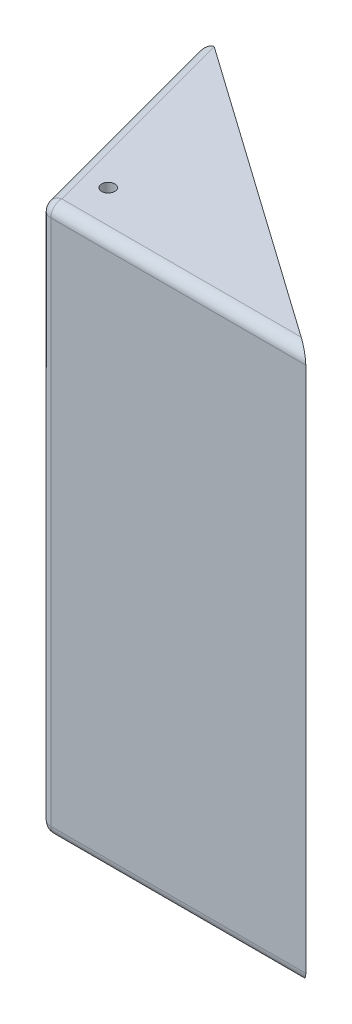
from build123d import *

# Parameters (mm, degrees)
BOSS_EXTRUDE1_DEPTH = 3.175
BOSS_EXTRUDE3_DEPTH = 152.4
BOSS_EXTRUDE4_DEPTH = 3.175
FILLET1_R           = 3.175
CHAMFER1_SIZE2      = 11.849261314
CHAMFER1_SIZE       = 3.175
SKETCH4_R           = 1.905
CUT_EXTRUDE1_DEPTH  = 158.75
CUT_EXTRUDE2_DEPTH  = 254


# Some blends are built 0.0001 mm under size
with BuildPart() as part:
    # Sketch1 → Boss-Extrude1 (new body)
    with BuildSketch(Plane(origin=(0, 0, 0), x_dir=(1, 0, 0), z_dir=(0, 1, 0))):
        Polygon((0, 0), (76.2, 0), (76.2, 63.5), (-17.014773719, 63.5), align=None)
    extrude(amount=BOSS_EXTRUDE1_DEPTH)

    # Sketch2 → Boss-Extrude3 (add)
    with BuildSketch(Plane(origin=(0, 3.175, 0), x_dir=(1, 0, 0), z_dir=(0, 1, 0))):
        Polygon((76.2, 0), (0, 0), (-17.014773719, 63.5), (-13.727771847, 63.5), (2.436263187, 3.175), (76.2, 3.175), align=None)
    extrude(amount=BOSS_EXTRUDE3_DEPTH)

    # Sketch3 → Boss-Extrude4 (add)
    with BuildSketch(Plane(origin=(0, 155.575, 0), x_dir=(1, 0, 0), z_dir=(0, 1, 0))):
        Polygon((-17.014773719, 63.5), (0, 0), (76.2, 0), (76.2, 63.5), align=None)
    extrude(amount=BOSS_EXTRUDE4_DEPTH)

    # Fillet1
    # the kernel refuses this fillet: 3.175 mm, written as the material it takes off along each edge
    with BuildSketch(Plane(origin=(2.436263187, 3.175, -3.175), x_dir=(-0.9659258262890689, 0, 0.2588190451025188), z_dir=(0, -1, 0))) as fillet1_piece_1_section:
        Polygon((0, 0), (FILLET1_R * 1.02, 0), (FILLET1_R * 1.02, -FILLET1_R * 0.782673527739), (FILLET1_R * 0.263995426005, -FILLET1_R * 0.985244342815), align=None)
    fillet1_piece_1 = extrude(amount=FILLET1_R * 1.02, mode=Mode.PRIVATE)
    fillet1_piece_1 = fillet1_piece_1 - Plane(origin=(2.436263187, 3.175, -3.175), x_dir=(0.6087614290087213, 0, -0.7933533402912346), z_dir=(0, -1, 0)) * Sphere(FILLET1_R, mode=Mode.PRIVATE)
    add(fillet1_piece_1, mode=Mode.SUBTRACT)
    with BuildSketch(Plane(origin=(2.436263187, 155.575, -3.175), x_dir=(0, 0, 1), z_dir=(0, 1, 0))) as fillet1_piece_2_section:
        Polygon((0, 0), (FILLET1_R * 1.02, 0), (FILLET1_R * 1.02, -FILLET1_R * 0.782673527739), (FILLET1_R * 0.263995426005, -FILLET1_R * 0.985244342815), align=None)
    fillet1_piece_2 = extrude(amount=FILLET1_R * 1.02, mode=Mode.PRIVATE)
    fillet1_piece_2 = fillet1_piece_2 - Plane(origin=(2.436263187, 155.575, -3.175), x_dir=(0.6087614290087213, 0, -0.7933533402912346), z_dir=(0, 1, 0)) * Sphere(FILLET1_R, mode=Mode.PRIVATE)
    add(fillet1_piece_2, mode=Mode.SUBTRACT)
    with BuildSketch(Plane(origin=(-17.014773719, 158.75, -63.5), x_dir=(1, 0, 0), z_dir=(0, -1, 0))) as fillet1_piece_3:
        with BuildLine():
            CenterArc((FILLET1_R * 1.30322537284, FILLET1_R), FILLET1_R, 165, 105)
            Line((FILLET1_R * 0.337299546552, FILLET1_R * 1.2588190451), (FILLET1_R * 0.317981030026, FILLET1_R * 1.263995426))
            Line((FILLET1_R * 0.317981030026, FILLET1_R * 1.263995426), (-FILLET1_R * 0.0260645074568, -FILLET1_R * 0.02))
            Line((-FILLET1_R * 0.0260645074568, -FILLET1_R * 0.02), (FILLET1_R * 1.30322537284, -FILLET1_R * 0.02))
            Line((FILLET1_R * 1.30322537284, -FILLET1_R * 0.02), (FILLET1_R * 1.30322537284, 0))
        make_face()
    extrude(amount=158.75, mode=Mode.SUBTRACT)
    with BuildSketch(Plane(origin=(2.436263187, 0, 0), x_dir=(0, 1, 0), z_dir=(1, 0, 0))) as fillet1_piece_4:
        with BuildLine():
            CenterArc((FILLET1_R, -FILLET1_R), FILLET1_R, 90, 90)
            Line((0, -FILLET1_R), (-FILLET1_R * 0.02, -FILLET1_R))
            Line((-FILLET1_R * 0.02, -FILLET1_R), (-FILLET1_R * 0.02, FILLET1_R * 0.02))
            Line((-FILLET1_R * 0.02, FILLET1_R * 0.02), (FILLET1_R, FILLET1_R * 0.02))
            Line((FILLET1_R, FILLET1_R * 0.02), (FILLET1_R, 0))
        make_face()
    extrude(amount=73.763736813, mode=Mode.SUBTRACT)
    with BuildSketch(Plane(origin=(-19.06914989, 0, -71.167036246), x_dir=(0.9659258262890688, 0, -0.25881904510251874), z_dir=(0.2588190451025188, 0, 0.9659258262890689))) as fillet1_piece_5_section:
        with BuildLine():
            CenterArc((FILLET1_R, FILLET1_R), FILLET1_R, 180, 90)
            Line((0, FILLET1_R), (-FILLET1_R * 0.02, FILLET1_R))
            Line((-FILLET1_R * 0.02, FILLET1_R), (-FILLET1_R * 0.02, -FILLET1_R * 0.02))
            Line((-FILLET1_R * 0.02, -FILLET1_R * 0.02), (FILLET1_R, -FILLET1_R * 0.02))
            Line((FILLET1_R, -FILLET1_R * 0.02), (FILLET1_R, 0))
        make_face()
    fillet1_piece_5 = extrude(amount=71.241274269, mode=Mode.PRIVATE)
    fillet1_piece_5 = split(fillet1_piece_5, bisect_by=Plane(origin=(-8.105416373, 0.719979608, -63.5), z_dir=(0, 0, 1)), keep=Keep.TOP, mode=Mode.PRIVATE)
    add(fillet1_piece_5, mode=Mode.SUBTRACT)
    with BuildSketch(Plane(origin=(0, 155.575, 0), x_dir=(1, 0, 0), z_dir=(0, -1, 0))) as fillet1_piece_6:
        with BuildLine():
            CenterArc((FILLET1_R * 0.767326987979, -FILLET1_R), FILLET1_R, 90, 75)
            Line((-FILLET1_R * 0.19859883831, -FILLET1_R * 0.741180954897), (-FILLET1_R * 0.217917354836, -FILLET1_R * 0.736004573995))
            Line((-FILLET1_R * 0.217917354836, -FILLET1_R * 0.736004573995), (-FILLET1_R * 0.0153465397596, FILLET1_R * 0.02))
            Line((-FILLET1_R * 0.0153465397596, FILLET1_R * 0.02), (FILLET1_R * 0.767326987979, FILLET1_R * 0.02))
            Line((FILLET1_R * 0.767326987979, FILLET1_R * 0.02), (FILLET1_R * 0.767326987979, 0))
        make_face()
    extrude(amount=152.4, mode=Mode.SUBTRACT)
    with BuildSketch(Plane(origin=(2.436263187, 158.75, 0), x_dir=(0, -1, 0), z_dir=(1, 0, 0))) as fillet1_piece_7:
        with BuildLine():
            CenterArc((FILLET1_R, FILLET1_R), FILLET1_R, 180, 90)
            Line((0, FILLET1_R), (-FILLET1_R * 0.02, FILLET1_R))
            Line((-FILLET1_R * 0.02, FILLET1_R), (-FILLET1_R * 0.02, -FILLET1_R * 0.02))
            Line((-FILLET1_R * 0.02, -FILLET1_R * 0.02), (FILLET1_R, -FILLET1_R * 0.02))
            Line((FILLET1_R, -FILLET1_R * 0.02), (FILLET1_R, 0))
        make_face()
    extrude(amount=73.763736813, mode=Mode.SUBTRACT)
    with BuildSketch(Plane(origin=(-19.06914989, 158.75, -71.167036246), x_dir=(0.9659258262890688, 0, -0.25881904510251874), z_dir=(0.2588190451025188, 0, 0.9659258262890689))) as fillet1_piece_8_section:
        with BuildLine():
            CenterArc((FILLET1_R, -FILLET1_R), FILLET1_R, 90, 90)
            Line((0, -FILLET1_R), (-FILLET1_R * 0.02, -FILLET1_R))
            Line((-FILLET1_R * 0.02, -FILLET1_R), (-FILLET1_R * 0.02, FILLET1_R * 0.02))
            Line((-FILLET1_R * 0.02, FILLET1_R * 0.02), (FILLET1_R, FILLET1_R * 0.02))
            Line((FILLET1_R, FILLET1_R * 0.02), (FILLET1_R, 0))
        make_face()
    fillet1_piece_8 = extrude(amount=71.241274269, mode=Mode.PRIVATE)
    fillet1_piece_8 = split(fillet1_piece_8, bisect_by=Plane(origin=(-8.105416373, 158.030020392, -63.5), z_dir=(0, 0, 1)), keep=Keep.TOP, mode=Mode.PRIVATE)
    add(fillet1_piece_8, mode=Mode.SUBTRACT)
    with BuildSketch(Plane(origin=(-17.014773719, 169.094351397, -63.5), x_dir=(1, 0, 0), z_dir=(0, -1, 0))) as fillet1_piece_9a_section:
        with BuildLine():
            CenterArc((FILLET1_R * 1.30322537284, FILLET1_R), FILLET1_R, 165, 105)
            Line((FILLET1_R * 0.337299546552, FILLET1_R * 1.2588190451), (FILLET1_R * 0.317981030026, FILLET1_R * 1.263995426))
            Line((FILLET1_R * 0.317981030026, FILLET1_R * 1.263995426), (-FILLET1_R * 0.0260645074568, -FILLET1_R * 0.02))
            Line((-FILLET1_R * 0.0260645074568, -FILLET1_R * 0.02), (FILLET1_R * 1.30322537284, -FILLET1_R * 0.02))
            Line((FILLET1_R * 1.30322537284, -FILLET1_R * 0.02), (FILLET1_R * 1.30322537284, 0))
        make_face()
    fillet1_piece_9a = extrude(amount=169.094351397, mode=Mode.PRIVATE)
    fillet1_piece_9a = split(fillet1_piece_9a, bisect_by=Plane(origin=(-15.793777483, 158.75, -62.563096636), z_dir=(0, 1, 0)), keep=Keep.TOP, mode=Mode.PRIVATE)
    with BuildSketch(Plane(origin=(-19.06914989, 158.75, -71.167036246), x_dir=(0.9659258262890688, 0, -0.25881904510251874), z_dir=(0.2588190451025188, 0, 0.9659258262890689))) as fillet1_piece_9b_section:
        with BuildLine():
            CenterArc((FILLET1_R, -FILLET1_R), FILLET1_R, 90, 90)
            Line((0, -FILLET1_R), (-FILLET1_R * 0.02, -FILLET1_R))
            Line((-FILLET1_R * 0.02, -FILLET1_R), (-FILLET1_R * 0.02, FILLET1_R * 0.02))
            Line((-FILLET1_R * 0.02, FILLET1_R * 0.02), (FILLET1_R, FILLET1_R * 0.02))
            Line((FILLET1_R, FILLET1_R * 0.02), (FILLET1_R, 0))
        make_face()
    fillet1_piece_9b = extrude(amount=71.241274269, mode=Mode.PRIVATE)
    fillet1_piece_9b = split(fillet1_piece_9b, bisect_by=Plane(origin=(-17.307274922, 158.04031756, -63.5), z_dir=(0, 0, -1)), keep=Keep.TOP, mode=Mode.PRIVATE)
    fillet1_piece_9 = fillet1_piece_9a & fillet1_piece_9b
    add(fillet1_piece_9, mode=Mode.SUBTRACT)
    with BuildSketch(Plane(origin=(-19.06914989, 0, -71.167036246), x_dir=(0.9659258262890688, 0, -0.25881904510251874), z_dir=(0.2588190451025188, 0, 0.9659258262890689))) as fillet1_piece_10a_section:
        with BuildLine():
            CenterArc((FILLET1_R, FILLET1_R), FILLET1_R, 180, 90)
            Line((0, FILLET1_R), (-FILLET1_R * 0.02, FILLET1_R))
            Line((-FILLET1_R * 0.02, FILLET1_R), (-FILLET1_R * 0.02, -FILLET1_R * 0.02))
            Line((-FILLET1_R * 0.02, -FILLET1_R * 0.02), (FILLET1_R, -FILLET1_R * 0.02))
            Line((FILLET1_R, -FILLET1_R * 0.02), (FILLET1_R, 0))
        make_face()
    fillet1_piece_10a = extrude(amount=71.241274269, mode=Mode.PRIVATE)
    fillet1_piece_10a = split(fillet1_piece_10a, bisect_by=Plane(origin=(-17.307274922, 0.70968244, -63.5), z_dir=(0, 0, -1)), keep=Keep.TOP, mode=Mode.PRIVATE)
    with BuildSketch(Plane(origin=(-17.014773719, 158.75, -63.5), x_dir=(1, 0, 0), z_dir=(0, -1, 0))) as fillet1_piece_10b_section:
        with BuildLine():
            CenterArc((FILLET1_R * 1.30322537284, FILLET1_R), FILLET1_R, 165, 105)
            Line((FILLET1_R * 0.337299546552, FILLET1_R * 1.2588190451), (FILLET1_R * 0.317981030026, FILLET1_R * 1.263995426))
            Line((FILLET1_R * 0.317981030026, FILLET1_R * 1.263995426), (-FILLET1_R * 0.0260645074568, -FILLET1_R * 0.02))
            Line((-FILLET1_R * 0.0260645074568, -FILLET1_R * 0.02), (FILLET1_R * 1.30322537284, -FILLET1_R * 0.02))
            Line((FILLET1_R * 1.30322537284, -FILLET1_R * 0.02), (FILLET1_R * 1.30322537284, 0))
        make_face()
    fillet1_piece_10b = extrude(amount=169.094351397, mode=Mode.PRIVATE)
    fillet1_piece_10b = split(fillet1_piece_10b, bisect_by=Plane(origin=(-15.793777483, 0, -62.563096636), z_dir=(0, -1, 0)), keep=Keep.TOP, mode=Mode.PRIVATE)
    fillet1_piece_10 = fillet1_piece_10a & fillet1_piece_10b
    add(fillet1_piece_10, mode=Mode.SUBTRACT)

    # Chamfer1
    chamfer1_edges = [part.edges().sort_by_distance(p)[0] for p in [
        (76.2, 79.375, -3.175),
    ]]
    chamfer1_side = [part.faces().sort_by_distance(p)[0] for p in [
        (76.2, 79.375, -3.1115),
    ]]
    chamfer(chamfer1_edges, length=CHAMFER1_SIZE - 0.0001, length2=CHAMFER1_SIZE2 - 0.0001, reference=chamfer1_side[0])  # a hair under: the kernel refuses the full size

    # Sketch4 → Cut-Extrude1 (cut)
    with BuildSketch(Plane.XZ):
        with Locations(Location((6.35, -12.7, 0), (0, 0, 270))):
            Circle(SKETCH4_R)
    extrude(amount=-CUT_EXTRUDE1_DEPTH, mode=Mode.SUBTRACT)

    # Sketch6 → Cut-Extrude2 (cut)
    with BuildSketch(Plane(origin=(0, 158.75, 0), x_dir=(1, 0, 0), z_dir=(0, 1, 0))):
        Polygon((-13.698783629, 63.391814498), (76.2, 0), (76.2, 63.5), (-15.882639691, 64.0756894), align=None)
    extrude(amount=-CUT_EXTRUDE2_DEPTH, mode=Mode.SUBTRACT)


solid = part.part
